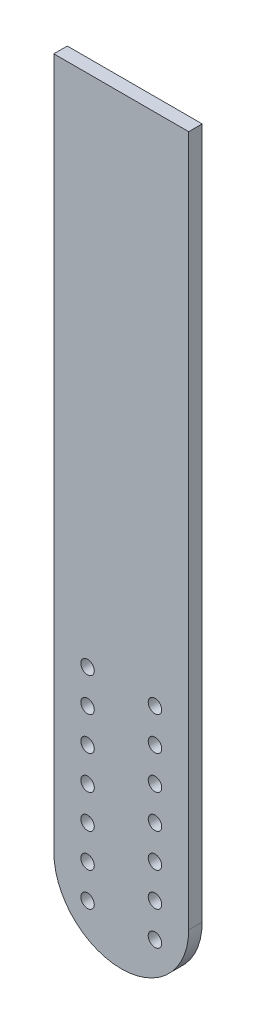
from build123d import *

# Parameters (mm, degrees)
SKETCH2_W           = 40
SKETCH2_H           = 225
BOSS_EXTRUDE1_DEPTH = 4
SKETCH3_R           = 2
CUT_EXTRUDE1_DEPTH  = 115.333940718
LPATTERN1_COUNT     = 7
LPATTERN1_PITCH     = 10
FILLET2_R           = 20


with BuildPart() as part:
    # Sketch2 → Boss-Extrude1 (new body)
    with BuildSketch(Plane.XY):
        Rectangle(SKETCH2_W, SKETCH2_H)
    extrude(amount=BOSS_EXTRUDE1_DEPTH)

    # Sketch3 → Cut-Extrude1 (cut, through all)
    with BuildSketch(Plane.XY.offset(4)):
        with Locations((-10, -100)):
            Circle(SKETCH3_R)
        with Locations((10, -100)):
            Circle(SKETCH3_R)
    cut_extrude1 = extrude(amount=-CUT_EXTRUDE1_DEPTH, mode=Mode.SUBTRACT)

    # LPattern1: Cut-Extrude1 ×7
    with Locations(*[(0, i * LPATTERN1_PITCH, 0) for i in range(1, LPATTERN1_COUNT)]):
        add(cut_extrude1, mode=Mode.SUBTRACT)

    # Fillet2
    fillet2_edges = [part.edges().sort_by_distance(p)[0] for p in [
        (20, -112.5, 2),
        (-20, -112.5, 2),
    ]]
    fillet(fillet2_edges, radius=FILLET2_R - 0.0001)  # a hair under: the kernel refuses the full size


solid = part.part
